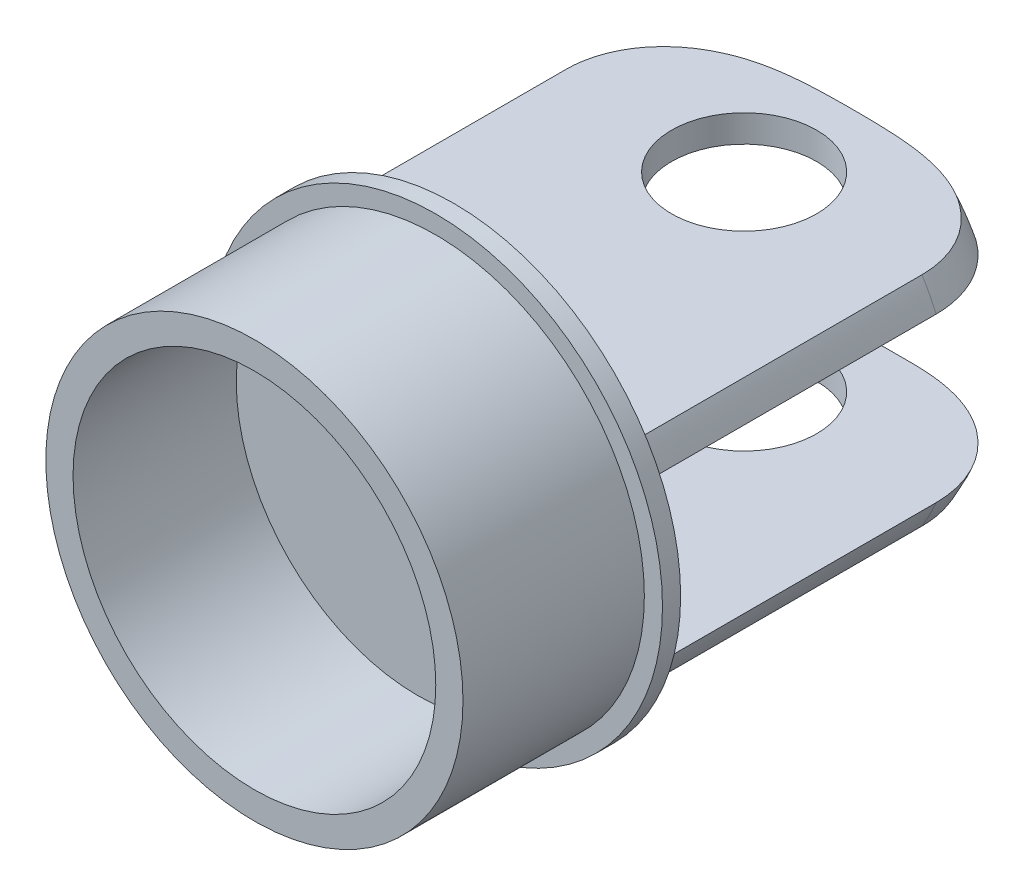
from build123d import *

# Parameters (mm, degrees)
BOSS_EXTRUDE1_DEPTH   = 10
BOSS_EXTRUDE2_START   = -1
SKETCH1_3_R           = 12.5
BOSS_EXTRUDE2_DEPTH   = 1
BOSS_EXTRUDE3_START   = -1
BOSS_EXTRUDE3_DEPTH   = 22
BOSS_EXTRUDE3_2_DEPTH = 22
SKETCH2_R             = 4
CUT_EXTRUDE1_DEPTH    = 33.05464085
FILLET1_R             = 6
FILLET4_R             = 6
SKETCH3_R             = 10
CUT_EXTRUDE2_DEPTH    = 9


with BuildPart() as part:
    # Sketch1 → Boss-Extrude1 (new body)
    with BuildSketch(Plane.XY):
        with BuildLine():
            ThreePointArc((9.810708435, 6), (0, 11.5), (-9.810708435, 6))
            Line((-9.810708435, 6), (9.810708435, 6))
        make_face()
        with BuildLine():
            Line((9.810708435, 6), (-9.810708435, 6))
            ThreePointArc((-9.810708435, 6), (-10.224401665, 5.264181854), (-10.583005244, 4.5))
            Line((-10.583005244, 4.5), (10.583005244, 4.5))
            ThreePointArc((10.583005244, 4.5), (10.224401665, 5.264181854), (9.810708435, 6))
        make_face()
        with BuildLine():
            Line((10.583005244, 4.5), (-10.583005244, 4.5))
            ThreePointArc((-10.583005244, 4.5), (-10.806701598, 3.932581923), (-11, 3.354101966))
            Line((-11, 3.354101966), (-11, -3.354101966))
            ThreePointArc((-11, -3.354101966), (-10.806701598, -3.932581923), (-10.583005244, -4.5))
            Line((-10.583005244, -4.5), (10.583005244, -4.5))
            ThreePointArc((10.583005244, -4.5), (10.806701598, -3.932581923), (11, -3.354101966))
            Line((11, -3.354101966), (11, 3.354101966))
            ThreePointArc((11, 3.354101966), (10.806701598, 3.932581923), (10.583005244, 4.5))
        make_face()
        with BuildLine():
            ThreePointArc((11.5, 0), (11.374313166, 1.695582496), (11, 3.354101966))
            Line((11, 3.354101966), (11, -3.354101966))
            ThreePointArc((11, -3.354101966), (11.374313166, -1.695582496), (11.5, 0))
        make_face()
        with BuildLine():
            Line((9.810708435, -6), (-9.810708435, -6))
            ThreePointArc((-9.810708435, -6), (0, -11.5), (9.810708435, -6))
        make_face()
        with BuildLine():
            Line((10.583005244, -4.5), (-10.583005244, -4.5))
            ThreePointArc((-10.583005244, -4.5), (-10.224401665, -5.264181854), (-9.810708435, -6))
            Line((-9.810708435, -6), (9.810708435, -6))
            ThreePointArc((9.810708435, -6), (10.224401665, -5.264181854), (10.583005244, -4.5))
        make_face()
        with BuildLine():
            Line((-11, -3.354101966), (-11, 3.354101966))
            ThreePointArc((-11, 3.354101966), (-11.5, 0), (-11, -3.354101966))
        make_face()
    extrude(amount=BOSS_EXTRUDE1_DEPTH)

    # Sketch1<3> → Boss-Extrude2 (add)
    # profile 1 of 8: a face of its own
    with BuildSketch(Plane.XY.offset(BOSS_EXTRUDE2_START)):
        Circle(SKETCH1_3_R)
        with BuildLine():
            ThreePointArc((-10.583005244, 4.5), (-10.224401665, 5.264181854), (-9.810708435, 6))
            ThreePointArc((-9.810708435, 6), (0, 11.5), (9.810708435, 6))
            ThreePointArc((9.810708435, 6), (10.224401665, 5.264181854), (10.583005244, 4.5))
            ThreePointArc((10.583005244, 4.5), (10.806701598, 3.932581923), (11, 3.354101966))
            ThreePointArc((11, 3.354101966), (11.374313166, 1.695582496), (11.5, 0))
            ThreePointArc((11.5, 0), (11.374313166, -1.695582496), (11, -3.354101966))
            ThreePointArc((11, -3.354101966), (10.806701598, -3.932581923), (10.583005244, -4.5))
            ThreePointArc((10.583005244, -4.5), (10.224401665, -5.264181854), (9.810708435, -6))
            ThreePointArc((9.810708435, -6), (0, -11.5), (-9.810708435, -6))
            ThreePointArc((-9.810708435, -6), (-10.224401665, -5.264181854), (-10.583005244, -4.5))
            ThreePointArc((-10.583005244, -4.5), (-10.806701598, -3.932581923), (-11, -3.354101966))
            ThreePointArc((-11, -3.354101966), (-11.5, 0), (-11, 3.354101966))
            ThreePointArc((-11, 3.354101966), (-10.806701598, 3.932581923), (-10.583005244, 4.5))
        make_face(mode=Mode.SUBTRACT)
    # profile 2 of 8: a face of its own
    with BuildSketch(Plane.XY.offset(BOSS_EXTRUDE2_START)):
        with BuildLine():
            Line((-11, -3.354101966), (-11, 3.354101966))
            ThreePointArc((-11, 3.354101966), (-11.5, 0), (-11, -3.354101966))
        make_face()
    # profile 3 of 8: a face of its own
    with BuildSketch(Plane.XY.offset(BOSS_EXTRUDE2_START)):
        with BuildLine():
            ThreePointArc((9.810708435, 6), (0, 11.5), (-9.810708435, 6))
            Line((-9.810708435, 6), (9.810708435, 6))
        make_face()
    # profile 4 of 8: a face of its own
    with BuildSketch(Plane.XY.offset(BOSS_EXTRUDE2_START)):
        with BuildLine():
            Line((9.810708435, 6), (-9.810708435, 6))
            ThreePointArc((-9.810708435, 6), (-10.224401665, 5.264181854), (-10.583005244, 4.5))
            Line((-10.583005244, 4.5), (10.583005244, 4.5))
            ThreePointArc((10.583005244, 4.5), (10.224401665, 5.264181854), (9.810708435, 6))
        make_face()
    # profile 5 of 8: a face of its own
    with BuildSketch(Plane.XY.offset(BOSS_EXTRUDE2_START)):
        with BuildLine():
            ThreePointArc((11.5, 0), (11.374313166, 1.695582496), (11, 3.354101966))
            Line((11, 3.354101966), (11, -3.354101966))
            ThreePointArc((11, -3.354101966), (11.374313166, -1.695582496), (11.5, 0))
        make_face()
    # profile 6 of 8: a face of its own
    with BuildSketch(Plane.XY.offset(BOSS_EXTRUDE2_START)):
        with BuildLine():
            Line((10.583005244, 4.5), (-10.583005244, 4.5))
            ThreePointArc((-10.583005244, 4.5), (-10.806701598, 3.932581923), (-11, 3.354101966))
            Line((-11, 3.354101966), (-11, -3.354101966))
            ThreePointArc((-11, -3.354101966), (-10.806701598, -3.932581923), (-10.583005244, -4.5))
            Line((-10.583005244, -4.5), (10.583005244, -4.5))
            ThreePointArc((10.583005244, -4.5), (10.806701598, -3.932581923), (11, -3.354101966))
            Line((11, -3.354101966), (11, 3.354101966))
            ThreePointArc((11, 3.354101966), (10.806701598, 3.932581923), (10.583005244, 4.5))
        make_face()
    # profile 7 of 8: a face of its own
    with BuildSketch(Plane.XY.offset(BOSS_EXTRUDE2_START)):
        with BuildLine():
            Line((10.583005244, -4.5), (-10.583005244, -4.5))
            ThreePointArc((-10.583005244, -4.5), (-10.224401665, -5.264181854), (-9.810708435, -6))
            Line((-9.810708435, -6), (9.810708435, -6))
            ThreePointArc((9.810708435, -6), (10.224401665, -5.264181854), (10.583005244, -4.5))
        make_face()
    # profile 8 of 8: a face of its own
    with BuildSketch(Plane.XY.offset(BOSS_EXTRUDE2_START)):
        with BuildLine():
            Line((9.810708435, -6), (-9.810708435, -6))
            ThreePointArc((-9.810708435, -6), (0, -11.5), (9.810708435, -6))
        make_face()
    extrude(amount=BOSS_EXTRUDE2_DEPTH)

    # Sketch3 → Cut-Extrude2 (cut)
    with BuildSketch(Plane.XY.offset(10)):
        Circle(SKETCH3_R)
    extrude(amount=-CUT_EXTRUDE2_DEPTH, mode=Mode.SUBTRACT)


with BuildPart() as body_2:
    # Sketch1<5> → Boss-Extrude3 (new body)
    with BuildSketch(Plane.XY.offset(BOSS_EXTRUDE3_START)):
        with BuildLine():
            Line((9.810708435, 6), (-9.810708435, 6))
            ThreePointArc((-9.810708435, 6), (-10.224401665, 5.264181854), (-10.583005244, 4.5))
            Line((-10.583005244, 4.5), (10.583005244, 4.5))
            ThreePointArc((10.583005244, 4.5), (10.224401665, 5.264181854), (9.810708435, 6))
        make_face()
    extrude(amount=-BOSS_EXTRUDE3_DEPTH)


with BuildPart() as body_3:
    # Sketch1<5> → Boss-Extrude3 2 (new body)
    with BuildSketch(Plane.XY.offset(BOSS_EXTRUDE3_START)):
        with BuildLine():
            Line((10.583005244, -4.5), (-10.583005244, -4.5))
            ThreePointArc((-10.583005244, -4.5), (-10.224401665, -5.264181854), (-9.810708435, -6))
            Line((-9.810708435, -6), (9.810708435, -6))
            ThreePointArc((9.810708435, -6), (10.224401665, -5.264181854), (10.583005244, -4.5))
        make_face()
    extrude(amount=-BOSS_EXTRUDE3_2_DEPTH)


with BuildPart() as cut_extrude1_tool:
    # Sketch2 → Cut-Extrude1 (new, through all)
    with BuildSketch(Plane.XZ.offset(6)):
        with Locations(Location((0, -17, 0), (0, 0, 270))):
            Circle(SKETCH2_R)
    extrude(amount=-CUT_EXTRUDE1_DEPTH)


with BuildPart() as body_2_1:
    add(body_2.part)

    # Cut-Extrude1: cut by cut_extrude1_tool
    add(cut_extrude1_tool.part, mode=Mode.SUBTRACT)

    # Fillet4
    # the kernel refuses this fillet: 6 mm, written as the material it takes off along each edge
    with BuildSketch(Plane(origin=(0, 0, -23), x_dir=(0.2787039750131438, 0.9603770584056415, 0), z_dir=(0.9603770584056415, -0.2787039750131438, 0))) as fillet4_piece_1:
        with BuildLine():
            CenterArc((11.5 - FILLET4_R, FILLET4_R), FILLET4_R, 270, 90)
            Line((11.5 - FILLET4_R, 0), (11.5, 0))
            Line((11.5, 0), (11.5, FILLET4_R))
        make_face()
    revolve(axis=Axis((0, 0, -23), (0, 0, 1)), revolution_arc=157.881072733, mode=Mode.SUBTRACT)
    with BuildSketch(Plane(origin=(0, 0, -23), x_dir=(0.6198036364033519, -0.7847569383581018, 0), z_dir=(-0.7847569383581018, -0.6198036364033519, 0))) as fillet4_piece_2:
        with BuildLine():
            CenterArc((11.5 - FILLET4_R, FILLET4_R), FILLET4_R, 270, 90)
            Line((11.5, FILLET4_R), (11.5, 0))
            Line((11.5, 0), (11.5 - FILLET4_R, 0))
        make_face()
    revolve(axis=Axis((0, 0, -23), (0, 0, 1)), revolution_arc=157.881072733, mode=Mode.SUBTRACT)


with BuildPart() as body_3_1:
    add(body_3.part)

    # Cut-Extrude1: cut by cut_extrude1_tool
    add(cut_extrude1_tool.part, mode=Mode.SUBTRACT)

    # Fillet1
    # the kernel refuses this fillet: 6 mm, written as the material it takes off along each edge
    with BuildSketch(Plane(origin=(0, 0, -23), x_dir=(-0.27870397501325017, -0.9603770584056106, 0), z_dir=(-0.9603770584056106, 0.27870397501325017, 0))) as fillet1_piece_1:
        with BuildLine():
            CenterArc((11.5 - FILLET1_R, FILLET1_R), FILLET1_R, 270, 90)
            Line((11.5 - FILLET1_R, 0), (11.5, 0))
            Line((11.5, 0), (11.5, FILLET1_R))
        make_face()
    revolve(axis=Axis((0, 0, -23), (0, 0, 1)), revolution_arc=157.881072733, mode=Mode.SUBTRACT)
    with BuildSketch(Plane(origin=(0, 0, -23), x_dir=(-0.6198036364032732, 0.784756938358164, 0), z_dir=(0.784756938358164, 0.6198036364032732, 0))) as fillet1_piece_2:
        with BuildLine():
            CenterArc((11.5 - FILLET1_R, FILLET1_R), FILLET1_R, 270, 90)
            Line((11.5, FILLET1_R), (11.5, 0))
            Line((11.5, 0), (11.5 - FILLET1_R, 0))
        make_face()
    revolve(axis=Axis((0, 0, -23), (0, 0, 1)), revolution_arc=157.881072733, mode=Mode.SUBTRACT)


solid = Compound([part.part, body_2_1.part, body_3_1.part])
